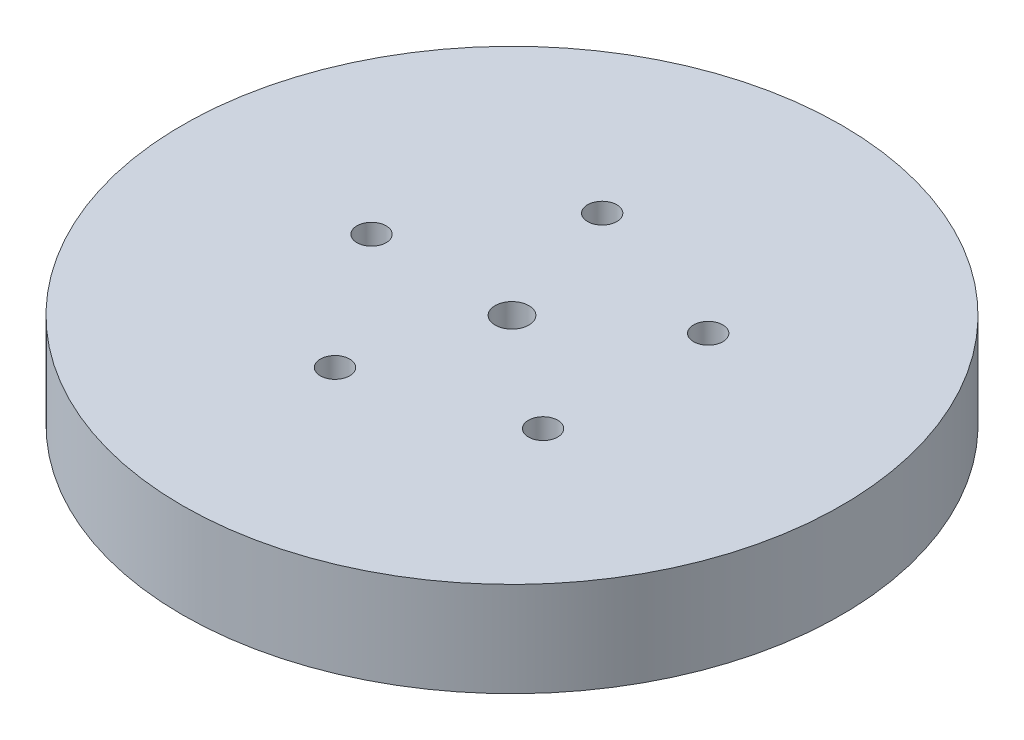
from build123d import *

# Parameters (mm, degrees)
SKETCH1_R           = 97.5
BOSS_EXTRUDE1_DEPTH = 28
SKETCH2_R           = 5
CUT_EXTRUDE1_DEPTH  = 141.700035537
SKETCH3_R           = 4.326572982
CUT_EXTRUDE2_DEPTH  = 16.807422219
CIRPATTERN1_COUNT   = 5


with BuildPart() as part:
    # Sketch1 → Boss-Extrude1 (new body)
    with BuildSketch(Plane(origin=(0, 0, 0), x_dir=(1, 0, 0), z_dir=(0, 1, 0))):
        Circle(SKETCH1_R)
    extrude(amount=BOSS_EXTRUDE1_DEPTH)

    # Sketch2 → Cut-Extrude1 (cut, through all)
    with BuildSketch(Plane(origin=(0, 0, 0), x_dir=(1, 0, 0), z_dir=(0, 1, 0))):
        Circle(SKETCH2_R)
    extrude(amount=CUT_EXTRUDE1_DEPTH, mode=Mode.SUBTRACT)

    # Sketch3 → Cut-Extrude2 (cut)
    with BuildSketch(Plane(origin=(0, 28, 0), x_dir=(1, 0, 0), z_dir=(0, 1, 0))):
        with Locations((-41.55757465, 0)):
            Circle(SKETCH3_R)
    cut_extrude2 = extrude(amount=-CUT_EXTRUDE2_DEPTH, mode=Mode.SUBTRACT)

    # CirPattern1: Cut-Extrude2 ×5 about axis
    cirpattern1_axis = Axis((0, 0, 0), (0, 1, 0))
    for i in range(1, CIRPATTERN1_COUNT):
        add(cut_extrude2.rotate(cirpattern1_axis, i * 360 / CIRPATTERN1_COUNT), mode=Mode.SUBTRACT)


solid = part.part
